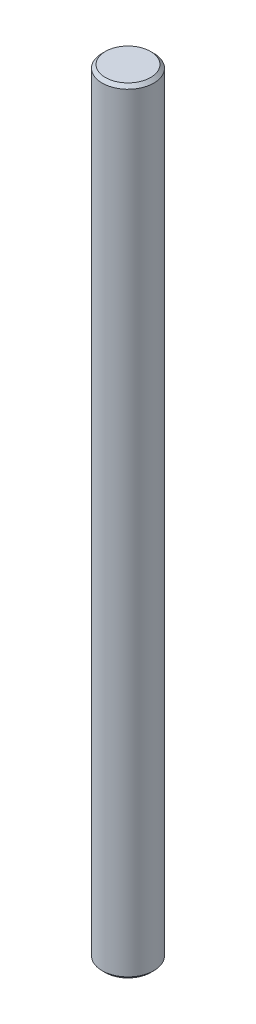
from build123d import *

# Parameters (mm, degrees)
SKETCH1_R           = 2
BOSS_EXTRUDE1_DEPTH = 30
CHAMFER1_SIZE       = 0.25


with BuildPart() as part:
    # Sketch1 → Boss-Extrude1 (new, symmetric)
    with BuildSketch(Plane(origin=(0, 0, 0), x_dir=(1, 0, 0), z_dir=(0, 1, 0))):
        Circle(SKETCH1_R)
    extrude(amount=BOSS_EXTRUDE1_DEPTH, both=True)

    # Chamfer1
    chamfer1_edges = [part.edges().sort_by_distance(p)[0] for p in [
        (-2, -30, 0),
        (-2, 30, 0),
    ]]
    chamfer(chamfer1_edges, length=CHAMFER1_SIZE)


solid = part.part
